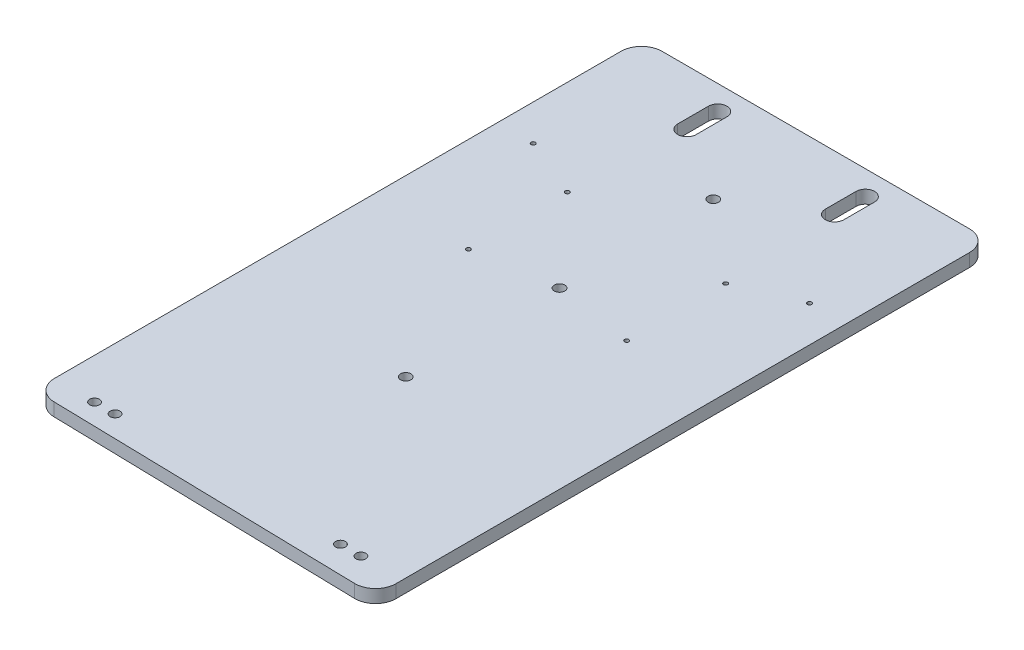
from build123d import *

# Parameters (mm, degrees)
PLATE_DEPTH                          = 6.35
FILLET1_R                            = 10
TRIPOD_SOCKET_TAP_DRILL_FOR_1_4_20_D = 5.1054
CAMERA_MOUNT_SCREW_CLEARANCE_DEPTH   = 352.602633461
ALIGNMENT_TAP_DRILL_FOR_M2_5_D       = 2.05
CLAMP_TAP_DRILL_FOR_M2_5_D           = 2.05
SKETCH11_R                           = 2.38125
CABLE_TIES_HOLES_DEPTH               = 352.602633461


with BuildPart() as part:
    # Sketch1 → plate (new body)
    with BuildSketch(Plane(origin=(0, 0, 0), x_dir=(1, 0, 0), z_dir=(0, 1, 0))):
        Polygon((13.637433785, 0), (183.637433785, 0), (183.637433785, -300), (13.637433785, -296.115361978), align=None)
    extrude(amount=PLATE_DEPTH)

    # Fillet1
    fillet1_edges = [part.edges().sort_by_distance(p)[0] for p in [
        (13.637433785, 3.175, 0),
        (183.637433785, 3.175, 0),
        (183.637433785, 3.175, 300),
        (13.637433785, 3.175, 296.115361978),
    ]]
    fillet(fillet1_edges, radius=FILLET1_R)

    # tripod socket Tap Drill for 1/4-20 (through all)
    with Locations(Plane(origin=(0, 0, 0), x_dir=(-1, 0, 0), z_dir=(0, -1, 0))):
        with Locations((-98.637433785, -50), (-98.637433785, -125), (-98.637433785, -200)):
            Hole(TRIPOD_SOCKET_TAP_DRILL_FOR_1_4_20_D / 2)

    # Sketch6 → camera mount screw clearance (cut, through all)
    with BuildSketch(Plane(origin=(0, 6.35, 0), x_dir=(1, 0, 0), z_dir=(0, 1, 0))):
        with BuildLine():
            Line((130.137433785, -26.845059814), (130.137433785, -11.845059814))
            ThreePointArc((130.137433785, -11.845059814), (134.637433785, -7.345059814), (139.137433785, -11.845059814))
            Line((139.137433785, -11.845059814), (139.137433785, -26.845059814))
            ThreePointArc((139.137433785, -26.845059814), (134.637433785, -31.345059814), (130.137433785, -26.845059814))
        make_face()
        with BuildLine():
            Line((58.137433785, -26.845059814), (58.137433785, -11.845059814))
            ThreePointArc((58.137433785, -11.845059814), (62.637433785, -7.345059814), (67.137433785, -11.845059814))
            Line((67.137433785, -11.845059814), (67.137433785, -26.845059814))
            ThreePointArc((67.137433785, -26.845059814), (62.637433785, -31.345059814), (58.137433785, -26.845059814))
        make_face()
    extrude(amount=-CAMERA_MOUNT_SCREW_CLEARANCE_DEPTH, mode=Mode.SUBTRACT)

    # alignment Tap Drill for M2.5 (through all)
    with Locations(Plane(origin=(0, 6.35, 0), x_dir=(1, 0, 0), z_dir=(0, 1, 0))):
        with Locations((60.027433785, -82.595059814), (137.247433785, -82.595059814), (137.247433785, -130.855059814), (60.027433785, -130.855059814)):
            Hole(ALIGNMENT_TAP_DRILL_FOR_M2_5_D / 2)

    # clamp Tap Drill for M2.5 (through all)
    with Locations(Plane(origin=(0, 6.35, 0), x_dir=(1, 0, 0), z_dir=(0, 1, 0))):
        with Locations((31.137433785, -70.35), (166.029512109, -70.453390828)):
            Hole(CLAMP_TAP_DRILL_FOR_M2_5_D / 2)

    # Sketch11 → cable ties holes (cut, through all)
    with BuildSketch(Plane(origin=(0, 6.35, 0), x_dir=(1, 0, 0), z_dir=(0, 1, 0))):
        with Locations(Location((33.408985301, -286.564547525, 0), (0, 0, 270))):
            Circle(SKETCH11_R)
        with Locations(Location((43.408985301, -286.564547525, 0), (0, 0, 270))):
            Circle(SKETCH11_R)
        with Locations(Location((153.426530966, -286.648872752, 0), (0, 0, 270))):
            Circle(SKETCH11_R)
        with Locations(Location((163.426519217, -286.664202157, 0), (0, 0, 270))):
            Circle(SKETCH11_R)
    extrude(amount=-CABLE_TIES_HOLES_DEPTH, mode=Mode.SUBTRACT)


solid = part.part
